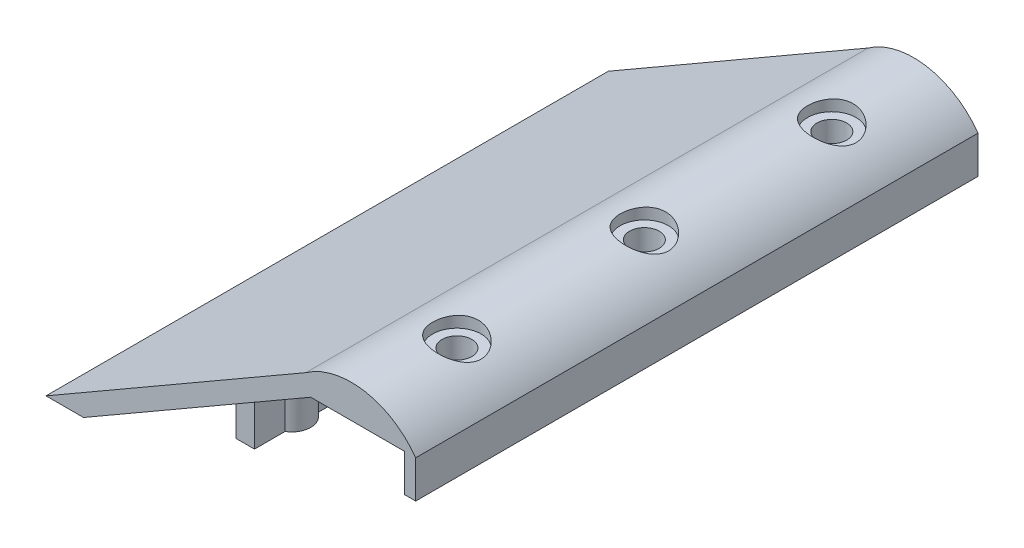
from build123d import *

# Parameters (mm, degrees)
SALIENTE_EXTRUIR1_DEPTH             = 75
SALIENTE_EXTRUIR2_DEPTH             = 17
SALIENTE_EXTRUIR2_DIRECTION_2_REACH = 107.747
CROQUIS3_R                          = 3.96875
CORTAR_EXTRUIR1_DEPTH               = 10
CROQUIS4_R                          = 6.46875
CROQUIS4_R_2                        = 3.96875
CORTAR_EXTRUIR2_DEPTH               = 3
SALIENTE_EXTRUIR3_REACH             = 113.971
CROQUIS7_R                          = 1.984375
CORTAR_EXTRUIR3_DEPTH               = 75
CROQUIS9_R                          = 1
CORTAR_EXTRUIR4_DEPTH               = 10


with BuildPart() as part:
    # Croquis1 → Saliente-Extruir1 (new, symmetric)
    with BuildSketch(Plane.XY):
        with BuildLine():
            Line((-60.621778265, -35), (0, 0))
            Line((0, 0), (25, 0))
            Line((25, 0), (25, -10))
            Line((25, -10), (28, -10))
            Line((28, -10), (28, 0))
            ThreePointArc((28, 0), (14.365660925, 8.576460347), (-1.339745962, 5))
            Line((-1.339745962, 5), (-70.621778265, -35))
            Line((-70.621778265, -35), (-60.621778265, -35))
        make_face()
    extrude(amount=SALIENTE_EXTRUIR1_DEPTH, both=True)

    # Croquis2 → Saliente-Extruir2 (add)
    with BuildSketch(Plane(origin=(0, -15, 0), x_dir=(1, 0, 0), z_dir=(0, 1, 0))):
        with BuildLine():
            Line((-32.5, 4.330127019), (-32.5, 12.5))
            Line((-32.5, 12.5), (-27.5, 12.5))
            Line((-27.5, 12.5), (-27.5, 4.330127019))
            ThreePointArc((-27.5, 4.330127019), (-25, 0), (-27.5, -4.330127019))
            Line((-27.5, -4.330127019), (-27.5, -12.5))
            Line((-27.5, -12.5), (-32.5, -12.5))
            Line((-32.5, -12.5), (-32.5, -4.330127019))
            ThreePointArc((-32.5, -4.330127019), (-35, 0), (-32.5, 4.330127019))
        make_face()
        with BuildLine():
            Line((-32.5, 54.330127019), (-32.5, 62.5))
            Line((-32.5, 62.5), (-27.5, 62.5))
            Line((-27.5, 62.5), (-27.5, 54.330127019))
            ThreePointArc((-27.5, 54.330127019), (-25, 50), (-27.5, 45.669872981))
            Line((-27.5, 45.669872981), (-27.5, 37.5))
            Line((-27.5, 37.5), (-32.5, 37.5))
            Line((-32.5, 37.5), (-32.5, 45.669872981))
            ThreePointArc((-32.5, 45.669872981), (-35, 50), (-32.5, 54.330127019))
        make_face()
        with BuildLine():
            Line((-32.5, -45.669872981), (-32.5, -37.5))
            Line((-32.5, -37.5), (-27.5, -37.5))
            Line((-27.5, -37.5), (-27.5, -45.669872981))
            ThreePointArc((-27.5, -45.669872981), (-25, -50), (-27.5, -54.330127019))
            Line((-27.5, -54.330127019), (-27.5, -62.5))
            Line((-27.5, -62.5), (-32.5, -62.5))
            Line((-32.5, -62.5), (-32.5, -54.330127019))
            ThreePointArc((-32.5, -54.330127019), (-35, -50), (-32.5, -45.669872981))
        make_face()
    extrude(amount=-SALIENTE_EXTRUIR2_DEPTH)

    # Saliente-Extruir2 direction 2: up to this face of the body (flat: up to its plane)
    saliente_extruir2_direction_2_end = Plane(part.part.faces().sort_by_distance((-30.310889132, -17.5, 0))[0])
    # Croquis2 → Saliente-Extruir2 direction 2 (add, up to the picked face)
    with BuildSketch(Plane(origin=(0, -15, 0), x_dir=(1, 0, 0), z_dir=(0, 1, 0)), mode=Mode.PRIVATE) as saliente_extruir2_direction_2_sk1:
        with BuildLine():
            Line((-32.5, 4.330127019), (-32.5, 12.5))
            Line((-32.5, 12.5), (-27.5, 12.5))
            Line((-27.5, 12.5), (-27.5, 4.330127019))
            ThreePointArc((-27.5, 4.330127019), (-25, 0), (-27.5, -4.330127019))
            Line((-27.5, -4.330127019), (-27.5, -12.5))
            Line((-27.5, -12.5), (-32.5, -12.5))
            Line((-32.5, -12.5), (-32.5, -4.330127019))
            ThreePointArc((-32.5, -4.330127019), (-35, 0), (-32.5, 4.330127019))
        make_face()
    saliente_extruir2_direction_2_tool1 = split(extrude(saliente_extruir2_direction_2_sk1.sketch, amount=SALIENTE_EXTRUIR2_DIRECTION_2_REACH, mode=Mode.PRIVATE), bisect_by=saliente_extruir2_direction_2_end, keep=Keep.BOTH, mode=Mode.PRIVATE)
    # Croquis2 → Saliente-Extruir2 direction 2 (add, up to the picked face)
    with BuildSketch(Plane(origin=(0, -15, 0), x_dir=(1, 0, 0), z_dir=(0, 1, 0)), mode=Mode.PRIVATE) as saliente_extruir2_direction_2_sk2:
        with BuildLine():
            Line((-32.5, 54.330127019), (-32.5, 62.5))
            Line((-32.5, 62.5), (-27.5, 62.5))
            Line((-27.5, 62.5), (-27.5, 54.330127019))
            ThreePointArc((-27.5, 54.330127019), (-25, 50), (-27.5, 45.669872981))
            Line((-27.5, 45.669872981), (-27.5, 37.5))
            Line((-27.5, 37.5), (-32.5, 37.5))
            Line((-32.5, 37.5), (-32.5, 45.669872981))
            ThreePointArc((-32.5, 45.669872981), (-35, 50), (-32.5, 54.330127019))
        make_face()
    saliente_extruir2_direction_2_tool2 = split(extrude(saliente_extruir2_direction_2_sk2.sketch, amount=SALIENTE_EXTRUIR2_DIRECTION_2_REACH, mode=Mode.PRIVATE), bisect_by=saliente_extruir2_direction_2_end, keep=Keep.BOTH, mode=Mode.PRIVATE)
    # Croquis2 → Saliente-Extruir2 direction 2 (add, up to the picked face)
    with BuildSketch(Plane(origin=(0, -15, 0), x_dir=(1, 0, 0), z_dir=(0, 1, 0)), mode=Mode.PRIVATE) as saliente_extruir2_direction_2_sk3:
        with BuildLine():
            Line((-32.5, -45.669872981), (-32.5, -37.5))
            Line((-32.5, -37.5), (-27.5, -37.5))
            Line((-27.5, -37.5), (-27.5, -45.669872981))
            ThreePointArc((-27.5, -45.669872981), (-25, -50), (-27.5, -54.330127019))
            Line((-27.5, -54.330127019), (-27.5, -62.5))
            Line((-27.5, -62.5), (-32.5, -62.5))
            Line((-32.5, -62.5), (-32.5, -54.330127019))
            ThreePointArc((-32.5, -54.330127019), (-35, -50), (-32.5, -45.669872981))
        make_face()
    saliente_extruir2_direction_2_tool3 = split(extrude(saliente_extruir2_direction_2_sk3.sketch, amount=SALIENTE_EXTRUIR2_DIRECTION_2_REACH, mode=Mode.PRIVATE), bisect_by=saliente_extruir2_direction_2_end, keep=Keep.BOTH, mode=Mode.PRIVATE)
    add(saliente_extruir2_direction_2_tool1.solids().sort_by(Axis((-30, -15, 0), (0, 1, 0)))[0])
    add(saliente_extruir2_direction_2_tool2.solids().sort_by(Axis((-30, -15, -50), (0, 1, 0)))[0])
    add(saliente_extruir2_direction_2_tool3.solids().sort_by(Axis((-30, -15, 50), (0, 1, 0)))[0])

    # Croquis3 → Cortar-Extruir1 (cut)
    with BuildSketch(Plane(origin=(0, 8.875562309, 0), x_dir=(1, 0, 0), z_dir=(0, 1, 0))):
        with Locations((14, 0)):
            Circle(CROQUIS3_R)
        with Locations((14, 50)):
            Circle(CROQUIS3_R)
        with Locations((14, -50)):
            Circle(CROQUIS3_R)
    extrude(amount=-CORTAR_EXTRUIR1_DEPTH, mode=Mode.SUBTRACT)

    # Croquis4 → Cortar-Extruir2 (cut)
    # profile 1 of 3: a face of its own
    with BuildSketch(Plane(origin=(0, 8.875562309, 0), x_dir=(1, 0, 0), z_dir=(0, 1, 0))):
        with Locations((14, 50)):
            Circle(CROQUIS4_R)
        with Locations((14, 50)):
            Circle(CROQUIS4_R_2, mode=Mode.SUBTRACT)
    # profile 2 of 3: a face of its own
    with BuildSketch(Plane(origin=(0, 8.875562309, 0), x_dir=(1, 0, 0), z_dir=(0, 1, 0))):
        with Locations((14, 0)):
            Circle(CROQUIS4_R)
        with Locations((14, 0)):
            Circle(CROQUIS4_R_2, mode=Mode.SUBTRACT)
    # profile 3 of 3: a face of its own
    with BuildSketch(Plane(origin=(0, 8.875562309, 0), x_dir=(1, 0, 0), z_dir=(0, 1, 0))):
        with Locations((14, -50)):
            Circle(CROQUIS4_R)
        with Locations((14, -50)):
            Circle(CROQUIS4_R_2, mode=Mode.SUBTRACT)
    extrude(amount=-CORTAR_EXTRUIR2_DEPTH, mode=Mode.SUBTRACT)

    # Saliente-Extruir3: up to this plane
    saliente_extruir3_end = Plane(origin=(0, 0, 75), z_dir=(-0.5000000000000012, 0.8660254037844379, 0))
    # Croquis7 → Saliente-Extruir3 (add, up to the surface)
    with BuildSketch(Plane(origin=(0, -35, 0), x_dir=(-1, 0, 0), z_dir=(0, -1, 0)), mode=Mode.PRIVATE) as saliente_extruir3_sk1:
        with Locations((50.621778265, 0)):
            Circle(CROQUIS7_R)
    saliente_extruir3_tool1 = split(extrude(saliente_extruir3_sk1.sketch, amount=-SALIENTE_EXTRUIR3_REACH, mode=Mode.PRIVATE), bisect_by=saliente_extruir3_end, keep=Keep.BOTH, mode=Mode.PRIVATE)
    add(saliente_extruir3_tool1.solids().sort_by_distance((-50.621778, -35, 0))[0])
    # Croquis7 → Saliente-Extruir3 (add, up to the surface)
    with BuildSketch(Plane(origin=(0, -35, 0), x_dir=(-1, 0, 0), z_dir=(0, -1, 0)), mode=Mode.PRIVATE) as saliente_extruir3_sk2:
        with Locations((50.621778265, 50)):
            Circle(CROQUIS7_R)
    saliente_extruir3_tool2 = split(extrude(saliente_extruir3_sk2.sketch, amount=-SALIENTE_EXTRUIR3_REACH, mode=Mode.PRIVATE), bisect_by=saliente_extruir3_end, keep=Keep.BOTH, mode=Mode.PRIVATE)
    add(saliente_extruir3_tool2.solids().sort_by_distance((-50.621778, -35, -50))[0])
    # Croquis7 → Saliente-Extruir3 (add, up to the surface)
    with BuildSketch(Plane(origin=(0, -35, 0), x_dir=(-1, 0, 0), z_dir=(0, -1, 0)), mode=Mode.PRIVATE) as saliente_extruir3_sk3:
        with Locations((50.621778265, -50)):
            Circle(CROQUIS7_R)
    saliente_extruir3_tool3 = split(extrude(saliente_extruir3_sk3.sketch, amount=-SALIENTE_EXTRUIR3_REACH, mode=Mode.PRIVATE), bisect_by=saliente_extruir3_end, keep=Keep.BOTH, mode=Mode.PRIVATE)
    add(saliente_extruir3_tool3.solids().sort_by_distance((-50.621778, -35, 50))[0])

    # Croquis8 → Cortar-Extruir3 (cut, symmetric)
    with BuildSketch(Plane.XY):
        with BuildLine():
            ThreePointArc((-50.621778265, -35), (-51.865537098, -34.58280791), (-52.606153265, -33.5))
            Line((-52.606153265, -33.5), (-52.606153265, -35))
            Line((-52.606153265, -35), (-50.621778265, -35))
        make_face()
        with BuildLine():
            ThreePointArc((-48.637403265, -33.5), (-49.378019432, -34.58280791), (-50.621778265, -35))
            Line((-50.621778265, -35), (-48.637403265, -35))
            Line((-48.637403265, -35), (-48.637403265, -33.5))
        make_face()
    extrude(amount=CORTAR_EXTRUIR3_DEPTH, both=True, mode=Mode.SUBTRACT)

    # Croquis9 → Cortar-Extruir4 (cut)
    with BuildSketch(Plane.XZ.offset(32)):
        with Locations((-30, 0)):
            Circle(CROQUIS9_R)
        with Locations((-30, 50)):
            Circle(CROQUIS9_R)
        with Locations((-30, -50)):
            Circle(CROQUIS9_R)
    extrude(amount=-CORTAR_EXTRUIR4_DEPTH, mode=Mode.SUBTRACT)


solid = part.part
